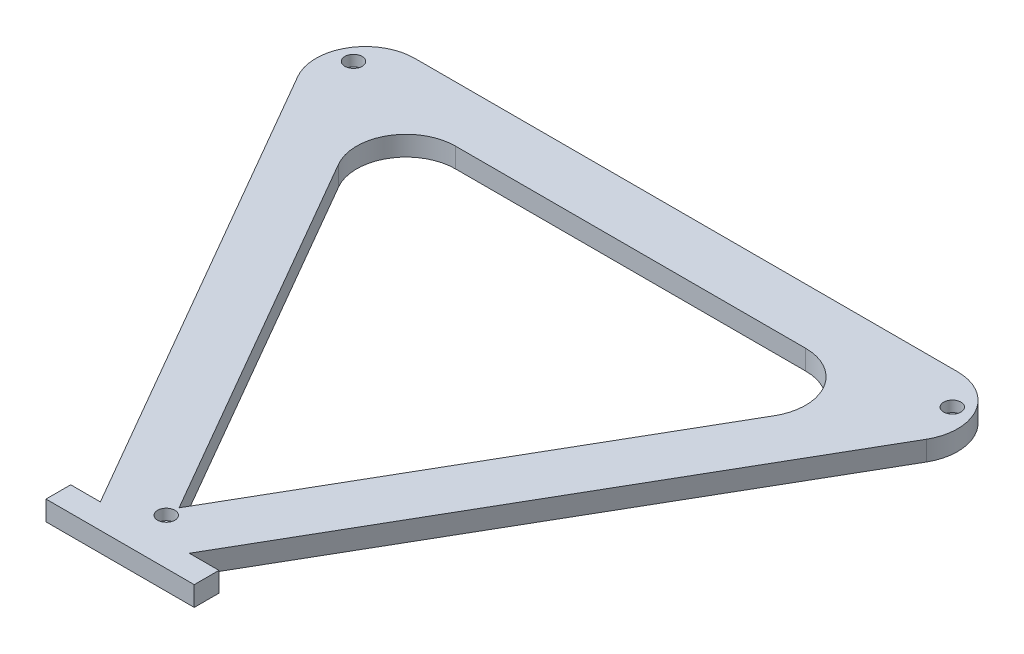
from build123d import *

# Parameters (mm, degrees)
BOSS_EXTRUDE1_DEPTH = 4
SKETCH2_R           = 1.75
CUT_EXTRUDE1_DEPTH  = 2.2


with BuildPart() as part:
    # Sketch1 → Boss-Extrude1 (new body)
    with BuildSketch(Plane(origin=(0, 0, 0), x_dir=(1, 0, 0), z_dir=(0, 1, 0))):
        with BuildLine():
            Line((-50.552239004, -73.99659536), (-105.141984966, 20.555618219))
            ThreePointArc((-105.141984966, 20.555618219), (-106.481730928, 25.555618219), (-105.141984966, 30.555618219))
            ThreePointArc((-105.141984966, 30.555618219), (-101.481730928, 34.215872257), (-96.481730928, 35.555618219))
            Line((-96.481730928, 35.555618219), (13.37725292, 35.555618219))
            ThreePointArc((13.37725292, 35.555618219), (18.37725292, 34.215872257), (22.037506958, 30.555618219))
            ThreePointArc((22.037506958, 30.555618219), (23.37725292, 25.555618219), (22.037506958, 20.555618219))
            Line((22.037506958, 20.555618219), (-32.552239004, -73.99659536))
            Line((-32.552239004, -73.99659536), (-26.552239004, -73.99659536))
            Line((-26.552239004, -73.99659536), (-26.552239004, -78.99659536))
            Line((-26.552239004, -78.99659536), (-36.552239004, -78.99659536))
            Line((-36.552239004, -78.99659536), (-46.552239004, -78.99659536))
            Line((-46.552239004, -78.99659536), (-56.552239004, -78.99659536))
            Line((-56.552239004, -78.99659536), (-56.552239004, -73.99659536))
            Line((-56.552239004, -73.99659536), (-50.552239004, -73.99659536))
        make_face()
        with BuildLine():
            Line((2.537506958, 9.29728797), (-41.552239004, -67.068392129))
            Line((-41.552239004, -67.068392129), (-85.641984966, 9.29728797))
            ThreePointArc((-85.641984966, 9.29728797), (-86.981730928, 14.29728797), (-85.641984966, 19.29728797))
            ThreePointArc((-85.641984966, 19.29728797), (-81.981730928, 22.957542008), (-76.981730928, 24.29728797))
            Line((-76.981730928, 24.29728797), (-6.12274708, 24.29728797))
            ThreePointArc((-6.12274708, 24.29728797), (-1.12274708, 22.957542008), (2.537506958, 19.29728797))
            ThreePointArc((2.537506958, 19.29728797), (3.87725292, 14.29728797), (2.537506958, 9.29728797))
        make_face(mode=Mode.SUBTRACT)
    extrude(amount=BOSS_EXTRUDE1_DEPTH)

    # Sketch2 → Cut-Extrude1 (cut)
    with BuildSketch(Plane(origin=(0, 4, 0), x_dir=(1, 0, 0), z_dir=(0, 1, 0))):
        with Locations((-41.552239004, -69.666468341)):
            Circle(SKETCH2_R)
        with Locations((-102.141984966, 28.823567412)):
            Circle(SKETCH2_R)
        with Locations((19.037506958, 28.823567412)):
            Circle(SKETCH2_R)
    extrude(amount=-CUT_EXTRUDE1_DEPTH, mode=Mode.SUBTRACT)


solid = part.part
